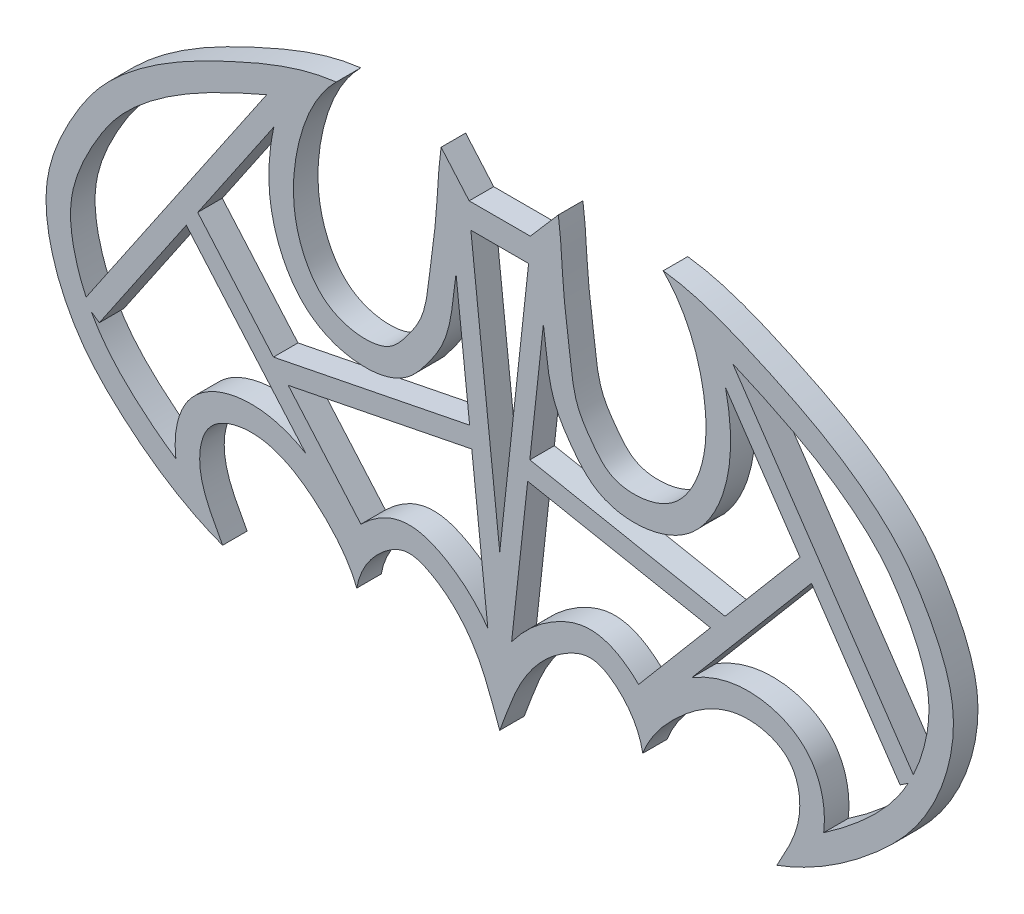
from build123d import *

# Parameters (mm, degrees)
BOSS_EXTRUDE1_DEPTH = 5
EXTRUDE_THIN1_DEPTH = 5


# Read off the part's stored shape, not the designer's step: Extrude-Thin1
with BuildPart() as part:
    # Sketch2 → Boss-Extrude1 (new body)
    with BuildSketch(Plane.XY):
        with BuildLine():
            add(Edge.make_bspline(
                [(11.943045602, 96.914702785), (12.576257325, 92.570447384), (12.682591437, 84.633650649), (14.328650043, 73.91293876), (15.084250611, 65.565192261), (18.782462905, 60.196801937), (22.093848988, 55.914002411), (28.676388483, 54.878042708), (35.58368105, 56.98450845), (40.402426049, 63.795974558), (42.469469032, 72.266995202), (41.385775786, 84.57199834), (37.627579097, 93.418641237), (33.304123482, 97.741502458)],
                knots=[0, 0, 0, 0, 0.131609134, 0.235936852, 0.328168247, 0.373910172, 0.430745972, 0.482425313, 0.562606572, 0.63404374, 0.721471283, 0.819469907, 1, 1, 1, 1], degree=3))
            add(Edge.make_bspline(
                [(33.304123482, 97.741502458), (38.731160072, 97.091424158), (46.17468532, 94.544397152), (55.786366426, 90.205259199), (65.092124116, 85.671514495), (74.32561703, 79.836336862), (82.46195138, 72.057999623), (88.431126043, 62.762914754), (93.141572793, 51.954476883), (92.060082581, 40.773626714), (89.043194045, 31.910390873), (84.151345054, 23.925704765), (73.600522812, 13.576646293), (64.158519745, 7.288846904), (56.460381097, 4.421183663)],
                knots=[0, 0, 0, 0, 0.114464817, 0.165055864, 0.222504688, 0.332841563, 0.39402653, 0.4580077, 0.565829824, 0.633836883, 0.689565344, 0.7627371, 0.828769582, 1, 1, 1, 1], degree=3))
            add(Edge.make_bspline(
                [(56.460381097, 4.421183663), (58.340801223, 7.930864686), (62.055922077, 13.853043126), (60.380560752, 25.360540718), (50.22960698, 28.299333784), (42.038564451, 25.291920255), (34.718418222, 19.381846295), (30.544628234, 14.264860134), (29.140925025, 10.517898436)],
                knots=[0, 0, 0, 0, 0.205854259, 0.35513432, 0.518085323, 0.666937553, 0.795303167, 1, 1, 1, 1], degree=3))
            add(Edge.make_bspline(
                [(29.140925025, 10.517898436), (28.494191825, 14.080659943), (25.604605862, 18.873242707), (19.033951273, 22.802729978), (13.643138045, 20.690573656), (8.592242397, 16.946778121), (3.340704888, 9.863814969), (1.374574458, 3.526617419), (0, 0)],
                knots=[0, 0, 0, 0, 0.229600613, 0.350520407, 0.447204325, 0.577023824, 0.75653792, 1, 1, 1, 1], degree=3))
            add(Edge.make_bspline(
                [(-29.140925025, 10.517898436), (-28.494191825, 14.080659943), (-25.604605862, 18.873242707), (-19.033951273, 22.802729978), (-13.643138045, 20.690573656), (-8.592242397, 16.946778121), (-3.340704888, 9.863814969), (-1.374574458, 3.526617419), (0, 0)],
                knots=[0, 0, 0, 0, 0.229600613, 0.350520407, 0.447204325, 0.577023824, 0.75653792, 1, 1, 1, 1], degree=3))
            add(Edge.make_bspline(
                [(-56.460381097, 4.421183663), (-58.340801223, 7.930864686), (-62.055922077, 13.853043126), (-60.380560752, 25.360540718), (-50.22960698, 28.299333784), (-42.038564451, 25.291920255), (-34.718418222, 19.381846295), (-30.544628234, 14.264860134), (-29.140925025, 10.517898436)],
                knots=[0, 0, 0, 0, 0.205854259, 0.35513432, 0.518085323, 0.666937553, 0.795303167, 1, 1, 1, 1], degree=3))
            add(Edge.make_bspline(
                [(-33.304123482, 97.741502458), (-38.731160072, 97.091424158), (-46.17468532, 94.544397152), (-55.786366426, 90.205259199), (-65.092124116, 85.671514495), (-74.32561703, 79.836336862), (-82.46195138, 72.057999623), (-88.431126043, 62.762914754), (-93.141572793, 51.954476883), (-92.060082581, 40.773626714), (-89.043194045, 31.910390873), (-84.151345054, 23.925704765), (-73.600522812, 13.576646293), (-64.158519745, 7.288846904), (-56.460381097, 4.421183663)],
                knots=[0, 0, 0, 0, 0.114464817, 0.165055864, 0.222504688, 0.332841563, 0.39402653, 0.4580077, 0.565829824, 0.633836883, 0.689565344, 0.7627371, 0.828769582, 1, 1, 1, 1], degree=3))
            add(Edge.make_bspline(
                [(-11.943045602, 96.914702785), (-12.576257325, 92.570447384), (-12.682591437, 84.633650649), (-14.328650043, 73.91293876), (-15.084250611, 65.565192261), (-18.782462905, 60.196801937), (-22.093848988, 55.914002411), (-28.676388483, 54.878042708), (-35.58368105, 56.98450845), (-40.402426049, 63.795974558), (-42.469469032, 72.266995202), (-41.385775786, 84.57199834), (-37.627579097, 93.418641237), (-33.304123482, 97.741502458)],
                knots=[0, 0, 0, 0, 0.131609134, 0.235936852, 0.328168247, 0.373910172, 0.430745972, 0.482425313, 0.562606572, 0.63404374, 0.721471283, 0.819469907, 1, 1, 1, 1], degree=3))
            Line((-11.943045602, 96.914702785), (-6.229286285, 90.309258259))
            Line((-6.229286285, 90.309258259), (6.229286285, 90.309258259))
            Line((6.229286285, 90.309258259), (11.943045602, 96.914702785))
        make_face()
        with BuildLine():
            add(Edge.make_bspline(
                [(44.148203501, 89.752935024), (44.804388054, 88.042557212), (45.878222865, 84.503910894), (46.857781891, 79.189404958), (47.178409702, 73.621547944), (46.587089486, 67.926178267), (45.158999591, 63.209329188), (43.353187195, 59.580780006), (41.575193037, 56.931500741), (39.281816071, 54.483665928), (36.377158041, 52.470484613), (33.24780204, 51.154916329), (29.956212377, 50.430992184), (27.200478416, 50.292402271), (24.872193654, 50.489126104), (23.068629779, 50.850512879), (21.24095835, 51.471682352), (19.399958795, 52.469540449), (17.902079032, 53.651824425), (16.272548715, 55.291280853), (15.061459481, 56.887333157), (14.058197714, 58.273700554), (12.995196252, 59.81766623), (11.940316702, 61.5984624), (11.091723341, 63.628198591), (10.454210497, 65.596818673), (9.933264468, 67.990126517), (9.562686508, 70.687027162), (9.292221468, 73.109315234), (8.889806163, 76.240244512), (8.344464238, 80.263375158), (8.012171823, 83.636971088), (7.89100695, 85.309258259)],
                knots=[0.112681319, 0.112681319, 0.112681319, 0.112681319, 0.160878589, 0.209075859, 0.25727313, 0.3054704, 0.35366767, 0.377766305, 0.40186494, 0.425963576, 0.450062211, 0.474160846, 0.498259481, 0.522358116, 0.534407434, 0.546456751, 0.558506069, 0.570555386, 0.582604704, 0.594654022, 0.618752657, 0.630801974, 0.642851292, 0.666949927, 0.678999245, 0.691048562, 0.715147197, 0.739245832, 0.763344468, 0.787443103, 0.835640373, 0.883837643, 0.883837643, 0.883837643, 0.883837643], degree=3))
            Line((7.89100695, 85.309258259), (-7.89100695, 85.309258259))
            add(Edge.make_bspline(
                [(-7.89100695, 85.309258259), (-8.012171823, 83.636971088), (-8.344464238, 80.263375158), (-8.889806163, 76.240244512), (-9.292221468, 73.109315234), (-9.562686508, 70.687027162), (-9.933264468, 67.990126517), (-10.454210497, 65.596818673), (-11.091723341, 63.628198591), (-11.940316702, 61.5984624), (-12.995196252, 59.81766623), (-14.058197714, 58.273700554), (-15.061459481, 56.887333157), (-16.272548715, 55.291280853), (-17.895533586, 53.658409743), (-19.009271762, 52.777745704), (-19.995879705, 52.155935152), (-20.613158183, 51.819758889), (-21.688087762, 51.319716776), (-23.068629779, 50.850512879), (-24.872193654, 50.489126104), (-27.200478416, 50.292402271), (-29.956212377, 50.430992184), (-33.24780204, 51.154916329), (-36.377158041, 52.470484613), (-39.281816071, 54.483665928), (-41.575193037, 56.931500741), (-43.353187195, 59.580780006), (-45.158999591, 63.209329188), (-46.587089486, 67.926178267), (-47.178409702, 73.621547944), (-46.857781891, 79.189404958), (-45.878222865, 84.503910894), (-44.804388054, 88.042557212), (-44.148203501, 89.752935024)],
                knots=[0.112681319, 0.112681319, 0.112681319, 0.112681319, 0.160878589, 0.209075859, 0.233174494, 0.25727313, 0.281371765, 0.3054704, 0.317519717, 0.329569035, 0.35366767, 0.365716988, 0.377766305, 0.40186494, 0.413914258, 0.425769978, 0.428782308, 0.434806967, 0.438012893, 0.450062211, 0.462111528, 0.474160846, 0.498259481, 0.522358116, 0.546456751, 0.570555386, 0.594654022, 0.618752657, 0.642851292, 0.691048562, 0.739245832, 0.787443103, 0.835640373, 0.883837643, 0.883837643, 0.883837643, 0.883837643], degree=3))
            add(Edge.make_bspline(
                [(-44.148203501, 89.752935024), (-45.217695914, 89.345900014), (-47.328969536, 88.49268152), (-51.588338644, 86.626868), (-56.934288318, 84.120560172), (-63.029874312, 80.931751814), (-67.8219274, 77.924085183), (-71.410746841, 75.280493915), (-73.973027576, 73.164198786), (-76.341172767, 70.930547034), (-78.43782967, 68.602974282), (-80.313257155, 66.07384708), (-82.060872368, 63.297835648), (-83.725245075, 60.306407216), (-85.65088514, 56.334391336), (-86.980258409, 52.381077224), (-87.475880531, 48.628154642), (-87.425024643, 44.679415749), (-86.437742408, 39.493457585), (-84.51614113, 34.587054207), (-82.466609363, 30.868496364), (-80.10518514, 27.347590686), (-76.578933646, 23.402670551), (-71.418071695, 18.848869914), (-67.8513693, 16.181661656), (-65.987625981, 14.938664031)],
                knots=[0.091932803, 0.091932803, 0.091932803, 0.091932803, 0.11726819, 0.142603577, 0.193274351, 0.243945125, 0.2946159, 0.319951287, 0.345286674, 0.370622061, 0.395957448, 0.421292835, 0.446628222, 0.471963609, 0.497298996, 0.547969771, 0.573305158, 0.598640545, 0.649311319, 0.699947498, 0.725282885, 0.750652867, 0.801323642, 0.851994416, 0.90266519, 0.90266519, 0.90266519, 0.90266519], degree=3))
            add(Edge.make_bspline(
                [(-65.987625981, 14.938664031), (-66.120891016, 16.038245645), (-66.209818604, 18.233611204), (-65.747953611, 21.680616641), (-64.698673781, 24.551488201), (-63.302011347, 26.744295833), (-61.498366456, 28.73495819), (-58.90336437, 30.487545108), (-55.596147193, 31.724869262), (-53.084742979, 32.151943023), (-51.144168493, 32.275558187), (-50.007414299, 32.275212125), (-48.067260518, 32.14815167), (-45.675866622, 31.728606309), (-41.787228023, 30.430572554), (-37.583416465, 28.077410554), (-34.032444826, 25.202159215), (-31.498673018, 22.78076107), (-30.246524267, 21.441123809), (-29.653423714, 20.75620954)],
                knots=[0.207248028, 0.207248028, 0.207248028, 0.207248028, 0.247968463, 0.288688897, 0.329409332, 0.349769549, 0.370129767, 0.410850201, 0.451570636, 0.491516024, 0.501696133, 0.52205635, 0.533011506, 0.57373194, 0.614452375, 0.695893245, 0.777334114, 0.818054549, 0.858774983, 0.858774983, 0.858774983, 0.858774983], degree=3))
            add(Edge.make_bspline(
                [(-29.653423714, 20.75620954), (-29.16723511, 21.336585696), (-28.1288553, 22.446283436), (-26.425173325, 23.937952442), (-24.392111322, 25.363864075), (-22.311289941, 26.357827312), (-20.368188279, 26.876547172), (-18.7347553, 27.061286187), (-17.123507571, 26.97183042), (-15.217143185, 26.599524199), (-13.179368381, 25.833632008), (-11.233090189, 24.825763644), (-9.410227584, 23.697954428), (-7.154803165, 22.023925094), (-4.653559824, 19.67420826), (-2.073912513, 16.501810376), (-0.646506807, 14.223335392), (0, 13.043599544)],
                knots=[0.16824761, 0.16824761, 0.16824761, 0.16824761, 0.204829248, 0.241410886, 0.277992525, 0.314574163, 0.332864983, 0.351155802, 0.369446621, 0.38773744, 0.424319079, 0.460900717, 0.497482356, 0.534063994, 0.607227271, 0.680390548, 0.753553825, 0.753553825, 0.753553825, 0.753553825], degree=3))
            add(Edge.make_bspline(
                [(0, 13.043599544), (0.646506807, 14.223335392), (2.073912513, 16.501810376), (4.653559824, 19.67420826), (7.154803165, 22.023925094), (9.410227584, 23.697954428), (11.233090189, 24.825763644), (13.179368381, 25.833632008), (15.217143185, 26.599524199), (17.123507571, 26.97183042), (18.7347553, 27.061286187), (20.368188279, 26.876547172), (22.311289941, 26.357827312), (24.392111322, 25.363864075), (26.425173325, 23.937952442), (28.1288553, 22.446283436), (29.16723511, 21.336585696), (29.653423714, 20.75620954)],
                knots=[0.16824761, 0.16824761, 0.16824761, 0.16824761, 0.241410886, 0.314574163, 0.38773744, 0.424319079, 0.460900717, 0.497482356, 0.534063994, 0.552354813, 0.570645633, 0.588936452, 0.607227271, 0.643808909, 0.680390548, 0.716972186, 0.753553825, 0.753553825, 0.753553825, 0.753553825], degree=3))
            add(Edge.make_bspline(
                [(29.653423714, 20.75620954), (30.246524267, 21.441123809), (31.498673018, 22.78076107), (34.032444826, 25.202159215), (37.583416465, 28.077410554), (41.787228023, 30.430572554), (45.675866622, 31.728606309), (48.837645475, 32.283307755), (52.19745531, 32.300612864), (55.575030738, 31.732769529), (58.90336437, 30.487545108), (61.498366456, 28.73495819), (63.302011347, 26.744295833), (64.698673781, 24.551488201), (65.747953611, 21.680616641), (66.209818604, 18.233611204), (66.120891016, 16.038245645), (65.987625981, 14.938664031)],
                knots=[0.207248028, 0.207248028, 0.207248028, 0.207248028, 0.247968463, 0.288688897, 0.370129767, 0.451570636, 0.492291071, 0.533011506, 0.57373194, 0.614452375, 0.65517281, 0.695893245, 0.716253462, 0.736613679, 0.777334114, 0.818054549, 0.858774983, 0.858774983, 0.858774983, 0.858774983], degree=3))
            add(Edge.make_bspline(
                [(65.987625981, 14.938664031), (67.8513693, 16.181661656), (71.418071695, 18.848869914), (76.578933646, 23.402670551), (80.10518514, 27.347590686), (82.466609363, 30.868496364), (84.51614113, 34.587054207), (86.437742408, 39.493457585), (87.425024643, 44.679415749), (87.475880531, 48.628154642), (86.980258409, 52.381077224), (85.65088514, 56.334391336), (83.725245075, 60.306407216), (82.060872368, 63.297835648), (80.313257155, 66.07384708), (78.43782967, 68.602974282), (76.341172767, 70.930547034), (73.973027576, 73.164198786), (71.410746841, 75.280493915), (67.8219274, 77.924085183), (63.029874312, 80.931751814), (56.934288318, 84.120560172), (51.588338644, 86.626868), (47.328969536, 88.49268152), (45.217695914, 89.345900014), (44.148203501, 89.752935024)],
                knots=[0.091932803, 0.091932803, 0.091932803, 0.091932803, 0.142603577, 0.193274351, 0.243945125, 0.269315108, 0.294650495, 0.345286674, 0.395957448, 0.421292835, 0.446628222, 0.497298996, 0.522634384, 0.547969771, 0.573305158, 0.598640545, 0.623975932, 0.649311319, 0.674646706, 0.699982093, 0.750652867, 0.801323642, 0.851994416, 0.877329803, 0.90266519, 0.90266519, 0.90266519, 0.90266519], degree=3))
        make_face(mode=Mode.SUBTRACT)
    extrude(amount=BOSS_EXTRUDE1_DEPTH)

    # Extrude-Thin1 outline → Extrude-Thin1 (add)
    with BuildSketch(Plane.XY):
        with BuildLine():
            Line((7.89100695, 85.309258259), (5.879118859, 85.309258259))
            Line((5.879118859, 85.309258259), (0, 31.468424037))
            Line((0, 31.468424037), (-5.879118859, 85.309258259))
            Line((-5.879118859, 85.309258259), (-7.89100695, 85.309258259))
            add(Edge.make_bspline(
                [(-7.89100695, 85.309258259), (-8.012171823, 83.636971088), (-8.32126756, 80.498879229), (-8.720333705, 77.494981318), (-8.900390913, 76.128348706)],
                knots=[0.112681319, 0.112681319, 0.112681319, 0.112681319, 0.160878589, 0.202346747, 0.202346747, 0.202346747, 0.202346747], degree=3))
            Line((-8.900390913, 76.128348706), (-6.132443597, 50.779551351))
            Line((-6.132443597, 50.779551351), (-46.101600265, 42.80581765))
            Line((-46.101600265, 42.80581765), (-61.531551298, 60.62437063))
            Line((-61.531551298, 60.62437063), (-46.018478358, 83.444281773))
            add(Edge.make_bspline(
                [(-46.018478358, 83.444281773), (-45.940859645, 83.797388401), (-45.448268123, 85.920756157), (-44.804388054, 88.042557212), (-44.148203501, 89.752935024)],
                knots=[0.826038694, 0.826038694, 0.826038694, 0.826038694, 0.835640373, 0.883837643, 0.883837643, 0.883837643, 0.883837643], degree=3))
            add(Edge.make_bspline(
                [(-44.148203501, 89.752935024), (-45.217695914, 89.345900014), (-46.32138388, 88.899872093), (-47.430103136, 88.432067177), (-47.478382577, 88.411659908)],
                knots=[0.091932803, 0.091932803, 0.091932803, 0.091932803, 0.11726819, 0.118421422, 0.118421422, 0.118421422, 0.118421422], degree=3))
            Line((-47.478382577, 88.411659908), (-84.263846339, 34.299813857))
            add(Edge.make_bspline(
                [(-84.263846339, 34.299813857), (-84.165215093, 34.091057759), (-83.834332298, 33.407744041), (-83.481406911, 32.733372458), (-83.225692028, 32.269493825)],
                knots=[0.694406135, 0.694406135, 0.694406135, 0.694406135, 0.699947498, 0.712615191, 0.712615191, 0.712615191, 0.712615191], degree=3))
            Line((-83.225692028, 32.269493825), (-81.5716885, 31.145095172))
            Line((-81.5716885, 31.145095172), (-63.858604616, 57.20124807))
            Line((-63.858604616, 57.20124807), (-39.533437331, 29.11047312))
            add(Edge.make_bspline(
                [(-39.533437331, 29.11047312), (-38.906638637, 28.749536456), (-36.700589244, 27.362577994), (-34.032444826, 25.202159215), (-31.498673018, 22.78076107), (-30.246524267, 21.441123809), (-29.653423714, 20.75620954)],
                knots=[0.665071067, 0.665071067, 0.665071067, 0.665071067, 0.695893245, 0.777334114, 0.818054549, 0.858774983, 0.858774983, 0.858774983, 0.858774983], degree=3))
            add(Edge.make_bspline(
                [(-29.653423714, 20.75620954), (-29.222685072, 21.270393615), (-28.766043482, 21.764541148), (-28.289513534, 22.23636734)],
                knots=[0.16824761, 0.16824761, 0.16824761, 0.16824761, 0.200657101, 0.200657101, 0.200657101, 0.200657101], degree=3))
            Line((-28.289513534, 22.23636734), (-43.089844177, 39.327832834))
            Line((-43.089844177, 39.327832834), (-5.69655442, 46.787688373))
            Line((-5.69655442, 46.787688373), (-2.427087909, 16.84598986))
            add(Edge.make_bspline(
                [(-2.427087909, 16.84598986), (-2.33272195, 16.71821744), (-1.44398642, 15.496300281), (-0.646506807, 14.223335392), (0, 13.043599544)],
                knots=[0.671802405, 0.671802405, 0.671802405, 0.671802405, 0.680390548, 0.753553825, 0.753553825, 0.753553825, 0.753553825], degree=3))
            add(Edge.make_bspline(
                [(0, 13.043599544), (0.646506807, 14.223335392), (1.44398642, 15.496300281), (2.33272195, 16.71821744), (2.427087909, 16.84598986)],
                knots=[0.16824761, 0.16824761, 0.16824761, 0.16824761, 0.241410886, 0.24999903, 0.24999903, 0.24999903, 0.24999903], degree=3))
            Line((2.427087909, 16.84598986), (5.697788609, 46.79899105))
            Line((5.697788609, 46.79899105), (42.940736081, 39.57026039))
            Line((42.940736081, 39.57026039), (28.287506312, 22.2383545))
            add(Edge.make_bspline(
                [(28.287506312, 22.2383545), (28.764761206, 21.765928648), (29.222080327, 21.271115515), (29.653423714, 20.75620954)],
                knots=[0.721098832, 0.721098832, 0.721098832, 0.721098832, 0.753553825, 0.753553825, 0.753553825, 0.753553825], degree=3))
            add(Edge.make_bspline(
                [(29.653423714, 20.75620954), (30.246524267, 21.441123809), (31.498673018, 22.78076107), (34.032444826, 25.202159215), (36.587561009, 27.27105809), (38.652764483, 28.588743013), (39.140842011, 28.880212263)],
                knots=[0.207248028, 0.207248028, 0.207248028, 0.207248028, 0.247968463, 0.288688897, 0.370129767, 0.39447124, 0.39447124, 0.39447124, 0.39447124], degree=3))
            Line((39.140842011, 28.880212263), (63.513725917, 57.708568657))
            Line((63.513725917, 57.708568657), (81.5716885, 31.145095172))
            Line((81.5716885, 31.145095172), (83.225692028, 32.269493825))
            add(Edge.make_bspline(
                [(83.225692028, 32.269493825), (83.481406911, 32.733372458), (83.834332298, 33.407744041), (84.165215093, 34.091057759), (84.263846339, 34.299813857)],
                knots=[0.281982802, 0.281982802, 0.281982802, 0.281982802, 0.294650495, 0.300191858, 0.300191858, 0.300191858, 0.300191858], degree=3))
            Line((84.263846339, 34.299813857), (47.478382577, 88.411659908))
            add(Edge.make_bspline(
                [(47.478382577, 88.411659908), (47.430103136, 88.432067177), (46.32138388, 88.899872093), (45.217695914, 89.345900014), (44.148203501, 89.752935024)],
                knots=[0.87617657, 0.87617657, 0.87617657, 0.87617657, 0.877329803, 0.90266519, 0.90266519, 0.90266519, 0.90266519], degree=3))
            add(Edge.make_bspline(
                [(44.148203501, 89.752935024), (44.804388054, 88.042557212), (45.448268121, 85.920756165), (45.940859641, 83.797388416), (46.018478353, 83.444281797)],
                knots=[0.112681319, 0.112681319, 0.112681319, 0.112681319, 0.160878589, 0.170480268, 0.170480268, 0.170480268, 0.170480268], degree=3))
            Line((46.018478353, 83.444281797), (61.179157113, 61.142746584))
            Line((61.179157113, 61.142746584), (45.9000266, 43.070522487))
            Line((45.9000266, 43.070522487), (6.133483479, 50.789074562))
            Line((6.133483479, 50.789074562), (8.900390908, 76.128348745))
            add(Edge.make_bspline(
                [(8.900390908, 76.128348745), (8.720333702, 77.494981345), (8.321267559, 80.498879243), (8.012171823, 83.636971088), (7.89100695, 85.309258259)],
                knots=[0.794172216, 0.794172216, 0.794172216, 0.794172216, 0.835640373, 0.883837643, 0.883837643, 0.883837643, 0.883837643], degree=3))
        make_face()
    extrude(amount=EXTRUDE_THIN1_DEPTH)


solid = part.part
